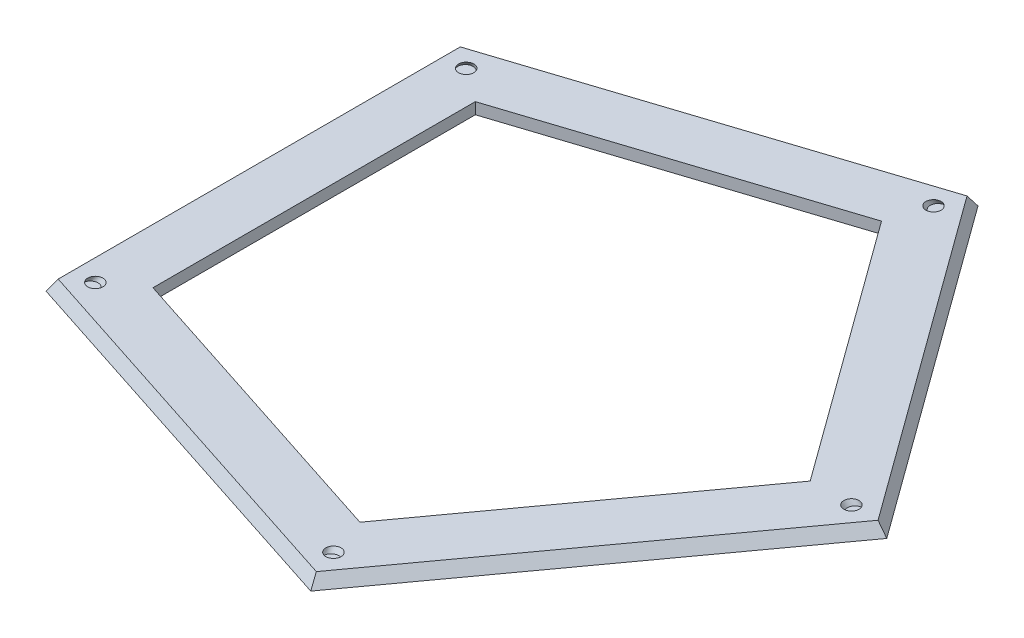
from build123d import *
from OCP.BRepFilletAPI import BRepFilletAPI_MakeChamfer

# Parameters (mm, degrees)
BOSS_EXTRUDE1_DEPTH = 3
CHAMFER1_SIZE       = 3
CHAMFER1_SIZE_2     = 1.853922924
CUT_EXTRUDE1_DEPTH  = 10
SKETCH2_R           = 2
CUT_EXTRUDE2_DEPTH  = 1.5
SKETCH5_R           = 2
CUT_EXTRUDE3_DEPTH  = 1.5
SKETCH9_R           = 2
CUT_EXTRUDE4_DEPTH  = 1.5
SKETCH10_R          = 2
CUT_EXTRUDE5_DEPTH  = 1.5
SKETCH11_R          = 2
CUT_EXTRUDE6_DEPTH  = 1.5


with BuildPart() as part:
    # Sketch1 → Boss-Extrude1 (new body)
    with BuildSketch(Plane(origin=(0, 0, 0), x_dir=(1, 0, 0), z_dir=(0, 1, 0))):
        Polygon((92.27247452, 0), (28.51376274, 87.756338167), (-74.65, 54.236399716), (-74.65, -54.236399716), (28.51376274, -87.756338167), align=None)
    extrude(amount=BOSS_EXTRUDE1_DEPTH)

    # Chamfer1
    chamfer1_edges_1 = [part.edges().sort_by_distance(p)[0] for p in [
        (-74.65, 3, 0),
    ]]
    chamfer1_side_1 = [part.faces().sort_by_distance(p)[0] for p in [
        (-74.65, 2.962921542, 0),
    ]]
    chamfer1_edges_2 = [part.edges().sort_by_distance(p)[0] for p in [
        (-23.06811863, 3, -70.996368941),
    ]]
    chamfer1_side_2 = [part.faces().sort_by_distance(p)[0] for p in [
        (-23.06811863, 2.962921542, -70.996368941),
    ]]
    chamfer1_edges_3 = [part.edges().sort_by_distance(p)[0] for p in [
        (60.39311863, 3, -43.878169084),
    ]]
    chamfer1_side_3 = [part.faces().sort_by_distance(p)[0] for p in [
        (60.39311863, 2.962921542, -43.878169084),
    ]]
    chamfer1_edges_4 = [part.edges().sort_by_distance(p)[0] for p in [
        (60.39311863, 3, 43.878169084),
    ]]
    chamfer1_side_4 = [part.faces().sort_by_distance(p)[0] for p in [
        (60.39311863, 2.962921542, 43.878169084),
    ]]
    chamfer1_edges_5 = [part.edges().sort_by_distance(p)[0] for p in [
        (-23.06811863, 3, 70.996368941),
    ]]
    chamfer1_side_5 = [part.faces().sort_by_distance(p)[0] for p in [
        (-23.06811863, 2.962921542, 70.996368941),
    ]]
    chamfer1 = BRepFilletAPI_MakeChamfer(part.part.solid().wrapped)
    for e in chamfer1_edges_1:
        chamfer1.Add(CHAMFER1_SIZE - 0.0001, CHAMFER1_SIZE_2 - 0.0001, e.wrapped, chamfer1_side_1[0].wrapped)
    for e in chamfer1_edges_2:
        chamfer1.Add(CHAMFER1_SIZE - 0.0001, CHAMFER1_SIZE_2 - 0.0001, e.wrapped, chamfer1_side_2[0].wrapped)
    for e in chamfer1_edges_3:
        chamfer1.Add(CHAMFER1_SIZE - 0.0001, CHAMFER1_SIZE_2 - 0.0001, e.wrapped, chamfer1_side_3[0].wrapped)
    for e in chamfer1_edges_4:
        chamfer1.Add(CHAMFER1_SIZE - 0.0001, CHAMFER1_SIZE_2 - 0.0001, e.wrapped, chamfer1_side_4[0].wrapped)
    for e in chamfer1_edges_5:
        chamfer1.Add(CHAMFER1_SIZE - 0.0001, CHAMFER1_SIZE_2 - 0.0001, e.wrapped, chamfer1_side_5[0].wrapped)
    add(Compound.cast(chamfer1.Shape()), mode=Mode.REPLACE)  # a hair under: the kernel refuses the full size

    # 3DSketch1 → Cut-Extrude1 (cut)
    with BuildSketch(Plane(origin=(-58.35, 0, -42.393756509), x_dir=(0.9510565162951536, 0, 0.3090169943749475), z_dir=(0, -1, 0))):
        Polygon((0, 0), (26.200782433, 80.637716756), (110.988295452, 80.637716756), (137.189077885, 0), (68.594538943, -49.836849731), align=None)
    extrude(amount=-CUT_EXTRUDE1_DEPTH, mode=Mode.SUBTRACT)

    # Sketch2 → Cut-Extrude2 (cut, along a direction that is not the sketch's normal)
    with BuildSketch(Plane(origin=(0, 3, 0), x_dir=(1, 0, 0), z_dir=(0, 1, 0))):
        with Locations((-67.132958116, 48.774949102)):
            Circle(SKETCH2_R)
    extrude(amount=-CUT_EXTRUDE2_DEPTH, dir=(0.4910935234360901, 0.7946827516361096, 0.3568003300043147), mode=Mode.SUBTRACT)

    # Sketch5 → Cut-Extrude3 (cut, along a direction that is not the sketch's normal)
    with BuildSketch(Plane(origin=(0, 3, 0), x_dir=(1, 0, 0), z_dir=(0, 1, 0))):
        with Locations((25.642508235, 78.919525446)):
            Circle(SKETCH5_R)
    extrude(amount=-CUT_EXTRUDE3_DEPTH, dir=(-0.1875810342976446, 0.7946827516361096, 0.577315061144162), mode=Mode.SUBTRACT)

    # Sketch9 → Cut-Extrude4 (cut, along a direction that is not the sketch's normal)
    with BuildSketch(Plane(origin=(0, 3, 0), x_dir=(1, 0, 0), z_dir=(0, 1, 0))):
        with Locations((82.980899762, 0)):
            Circle(SKETCH9_R)
    extrude(amount=-CUT_EXTRUDE4_DEPTH, dir=(-0.6070249782768915, 0.7946827516361101, 3.1127032543975076e-15), mode=Mode.SUBTRACT)

    # Sketch10 → Cut-Extrude5 (cut, along a direction that is not the sketch's normal)
    with BuildSketch(Plane(origin=(0, 3, 0), x_dir=(1, 0, 0), z_dir=(0, 1, 0))):
        with Locations((25.642508235, -78.919525446)):
            Circle(SKETCH10_R)
    extrude(amount=-CUT_EXTRUDE5_DEPTH, dir=(-0.18758103429764075, 0.7946827516361107, -0.5773150611441616), mode=Mode.SUBTRACT)

    # Sketch11 → Cut-Extrude6 (cut, along a direction that is not the sketch's normal)
    with BuildSketch(Plane(origin=(0, 3, 0), x_dir=(1, 0, 0), z_dir=(0, 1, 0))):
        with Locations((-67.132958116, -48.774949102)):
            Circle(SKETCH11_R)
    extrude(amount=-CUT_EXTRUDE6_DEPTH, dir=(0.49109352343609003, 0.7946827516361095, -0.35680033000431516), mode=Mode.SUBTRACT)


solid = part.part
